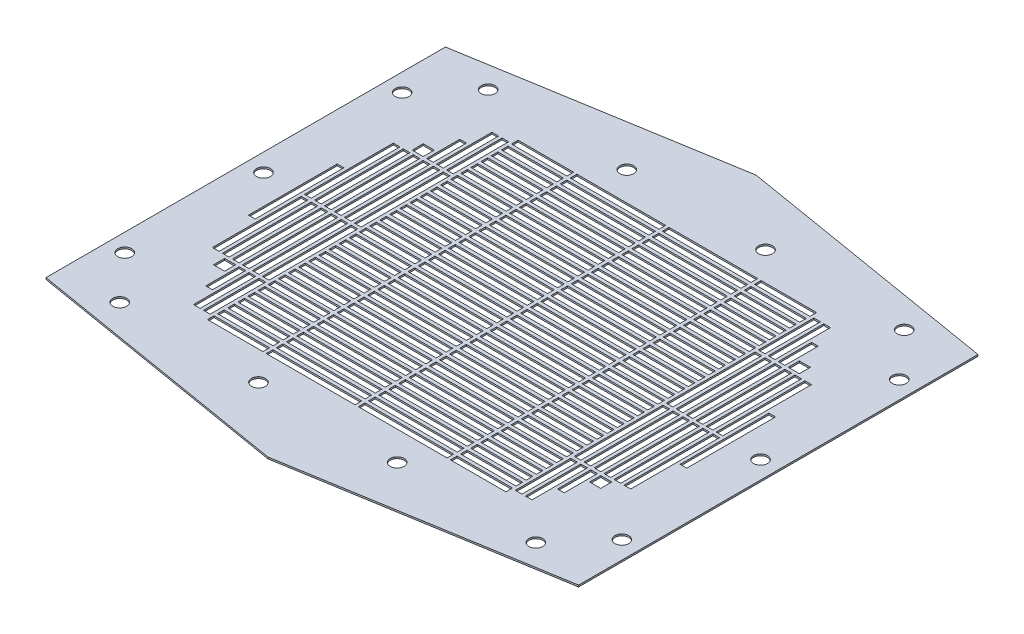
from build123d import *

# Parameters (mm, degrees)
BASE_FLANGE1_DEPTH                    = 200
BASE_FLANGE2_START                    = -1.5
BASE_FLANGE2_DEPTH                    = 1.5
SKETCH9_W                             = 6.25
SKETCH9_H                             = 1.5
F_12_5_12_5_DIAMETER_HOLE2_AT_2_COUNT = 2
F_12_5_12_5_DIAMETER_HOLE2_AT_2_PITCH = 250
F_12_5_12_5_DIAMETER_HOLE2_AT_3_COUNT = 2
F_12_5_12_5_DIAMETER_HOLE2_AT_3_PITCH = 125
F_12_5_12_5_DIAMETER_HOLE2_AT_4_COUNT = 2
F_12_5_12_5_DIAMETER_HOLE2_AT_4_PITCH = 465.111814513
F_12_5_12_5_DIAMETER_HOLE2_AT_5_COUNT = 2
F_12_5_12_5_DIAMETER_HOLE2_AT_5_PITCH = 513.034111926
F_12_5_12_5_DIAMETER_HOLE2_AT_6_COUNT = 2
F_12_5_12_5_DIAMETER_HOLE2_AT_6_PITCH = 448
SKETCH11_W                            = 6.25
SKETCH11_H                            = 1.5
F_12_5_12_5_DIAMETER_HOLE3_AT_2_COUNT = 2
F_12_5_12_5_DIAMETER_HOLE3_AT_2_PITCH = 332
CRVPATTERN1_COUNT                     = 4
CRVPATTERN1_PITCH                     = 125
CRVPATTERN1_COPY_1_SKETCH_W           = 6.25
CRVPATTERN1_COPY_1_SKETCH_H           = 1.5
CRVPATTERN1_COPY_2_SKETCH_W           = 6.25
CRVPATTERN1_COPY_2_SKETCH_H           = 1.5
CRVPATTERN1_COPY_3_SKETCH_W           = 6.25
CRVPATTERN1_COPY_3_SKETCH_H           = 1.5
BASE_FLANGE3_DEPTH                    = 1.5
SKETCH14_W                            = 80
SKETCH14_H                            = 6
SKETCH14_W_2                          = 50
EXTRUDE1_DEPTH                        = 10
CRVPATTERN2_START                     = -81.5
CRVPATTERN2_OUTLINE_W                 = 1.5
CRVPATTERN2_OUTLINE_H                 = 6
CRVPATTERN2_DEPTH                     = 80
CRVPATTERN2_START_2                   = -134.5
CRVPATTERN2_2_OUTLINE_W               = 1.5
CRVPATTERN2_2_OUTLINE_H               = 6
CRVPATTERN2_2_DEPTH                   = 50
SKETCH15_W                            = 6
SKETCH15_H                            = 80
SKETCH15_H_2                          = 50
SKETCH15_H_3                          = 30
SKETCH15_W_2                          = 10
SKETCH15_H_4                          = 10
EXTRUDE2_DEPTH                        = 10


# Read off the part's stored shape, not the designer's step: CrvPattern2
# Sheet-metal steps are written as plain solids
with BuildPart() as part:
    # Sketch1 → Base-Flange1 (new body)
    with BuildSketch(Plane(origin=(0, 0, 0), x_dir=(1, 0, 0), z_dir=(0, 1, 0))):
        with BuildLine():
            ThreePointArc((-0.005, 198.999999937), (0, -199), (0.005, 198.999999937))
            Line((0.005, 198.999999937), (0.005025126, 199.999999937))
            ThreePointArc((0.005025126, 199.999999937), (0, -200), (-0.005025126, 199.999999937))
            Line((-0.005025126, 199.999999937), (-0.005, 198.999999937))
        make_face()
    extrude(amount=BASE_FLANGE1_DEPTH)


with BuildPart() as body_2:
    # Sketch4 → Base-Flange2 (new body)
    with BuildSketch(Plane(origin=(0, 0, 0), x_dir=(1, 0, 0), z_dir=(0, 1, 0)).offset(BASE_FLANGE2_START)):
        Polygon((240, 180), (240, -180), (0, -220), (-240, -180), (-240, 180), (0, 220), align=None)
        with BuildLine():
            Line((143.038535018, 140), (-142.828568571, 140))
            ThreePointArc((-142.828568571, 140), (-200, 0), (-142.828568571, -140))
            Line((-142.828568571, -140), (143.038535018, -140))
            ThreePointArc((143.038535018, -140), (200.15, 0), (143.038535018, 140))
        make_face(mode=Mode.SUBTRACT)
    extrude(amount=BASE_FLANGE2_DEPTH)

    # Sketch9 → Ø12.5 (12.5) Diameter Hole2 (revolve, cut)
    with BuildSketch(Plane(origin=(-224, 0, -125), x_dir=(0, 0, 1), z_dir=(1, 0, 0))):
        with Locations((3.125, 0.75)):
            Rectangle(SKETCH9_W, SKETCH9_H)
    f_12_5_12_5_diameter_hole2 = revolve(axis=Axis((-224, 6.35, -125), (0, -1, 0)), mode=Mode.SUBTRACT)

    # Ø12.5 (12.5) Diameter Hole2 at 2: Ø12.5 (12.5) Diameter Hole2 ×2
    with Locations(*[(0, 0, i * F_12_5_12_5_DIAMETER_HOLE2_AT_2_PITCH) for i in range(1, F_12_5_12_5_DIAMETER_HOLE2_AT_2_COUNT)]):
        add(f_12_5_12_5_diameter_hole2, mode=Mode.SUBTRACT)

    # Ø12.5 (12.5) Diameter Hole2 at 3: Ø12.5 (12.5) Diameter Hole2 ×2
    with Locations(*[(0, 0, i * F_12_5_12_5_DIAMETER_HOLE2_AT_3_PITCH) for i in range(1, F_12_5_12_5_DIAMETER_HOLE2_AT_3_COUNT)]):
        add(f_12_5_12_5_diameter_hole2, mode=Mode.SUBTRACT)

    # Ø12.5 (12.5) Diameter Hole2 at 4: Ø12.5 (12.5) Diameter Hole2 ×2
    with Locations(*[Vector(0.9632092456491202, 0, 0.2687525797012055) * (i * F_12_5_12_5_DIAMETER_HOLE2_AT_4_PITCH) for i in range(1, F_12_5_12_5_DIAMETER_HOLE2_AT_4_COUNT)]):
        add(f_12_5_12_5_diameter_hole2, mode=Mode.SUBTRACT)

    # Ø12.5 (12.5) Diameter Hole2 at 5: Ø12.5 (12.5) Diameter Hole2 ×2
    with Locations(*[Vector(0.8732362811468641, 0, 0.4872970318899912) * (i * F_12_5_12_5_DIAMETER_HOLE2_AT_5_PITCH) for i in range(1, F_12_5_12_5_DIAMETER_HOLE2_AT_5_COUNT)]):
        add(f_12_5_12_5_diameter_hole2, mode=Mode.SUBTRACT)

    # Ø12.5 (12.5) Diameter Hole2 at 6: Ø12.5 (12.5) Diameter Hole2 ×2
    with Locations(*[(i * F_12_5_12_5_DIAMETER_HOLE2_AT_6_PITCH, 0, 0) for i in range(1, F_12_5_12_5_DIAMETER_HOLE2_AT_6_COUNT)]):
        add(f_12_5_12_5_diameter_hole2, mode=Mode.SUBTRACT)

    # Sketch11 → Ø12.5 (12.5) Diameter Hole3 (revolve, cut)
    with BuildSketch(Plane(origin=(-187.5, 0, -166), x_dir=(0, 0, 1), z_dir=(1, 0, 0))):
        with Locations((3.125, 0.75)):
            Rectangle(SKETCH11_W, SKETCH11_H)
    f_12_5_12_5_diameter_hole3 = revolve(axis=Axis((-187.5, 6.35, -166), (0, -1, 0)), mode=Mode.SUBTRACT)

    # Ø12.5 (12.5) Diameter Hole3 at 2: Ø12.5 (12.5) Diameter Hole3 ×2
    with Locations(*[(0, 0, i * F_12_5_12_5_DIAMETER_HOLE3_AT_2_PITCH) for i in range(1, F_12_5_12_5_DIAMETER_HOLE3_AT_2_COUNT)]):
        add(f_12_5_12_5_diameter_hole3, mode=Mode.SUBTRACT)

    # CrvPattern1: Ø12.5 (12.5) Diameter Hole3 ×4
    with Locations(*[(i * CRVPATTERN1_PITCH, 0, 0) for i in range(1, CRVPATTERN1_COUNT)]):
        add(f_12_5_12_5_diameter_hole3, mode=Mode.SUBTRACT)

    # CrvPattern1 copy 1 sketch → CrvPattern1 copy 1 (revolve, cut)
    with BuildSketch(Plane(origin=(-62.5, 0, 166), x_dir=(0, 0, 1), z_dir=(1, 0, 0))):
        with Locations((3.125, 0.75)):
            Rectangle(CRVPATTERN1_COPY_1_SKETCH_W, CRVPATTERN1_COPY_1_SKETCH_H)
    revolve(axis=Axis((-62.5, 6.35, 166), (0, -1, 0)), mode=Mode.SUBTRACT)

    # CrvPattern1 copy 2 sketch → CrvPattern1 copy 2 (revolve, cut)
    with BuildSketch(Plane(origin=(62.5, 0, 166), x_dir=(0, 0, 1), z_dir=(1, 0, 0))):
        with Locations((3.125, 0.75)):
            Rectangle(CRVPATTERN1_COPY_2_SKETCH_W, CRVPATTERN1_COPY_2_SKETCH_H)
    revolve(axis=Axis((62.5, 6.35, 166), (0, -1, 0)), mode=Mode.SUBTRACT)

    # CrvPattern1 copy 3 sketch → CrvPattern1 copy 3 (revolve, cut)
    with BuildSketch(Plane(origin=(187.5, 0, 166), x_dir=(0, 0, 1), z_dir=(1, 0, 0))):
        with Locations((3.125, 0.75)):
            Rectangle(CRVPATTERN1_COPY_3_SKETCH_W, CRVPATTERN1_COPY_3_SKETCH_H)
    revolve(axis=Axis((187.5, 6.35, 166), (0, -1, 0)), mode=Mode.SUBTRACT)

    # Sketch13 → Base-Flange3 (add)
    with BuildSketch(Plane.XZ.offset(1.5)):
        with BuildLine():
            Line((-142.828568571, -140), (143.038535018, -140))
            ThreePointArc((143.038535018, -140), (200.15, 0), (143.038535018, 140))
            Line((143.038535018, 140), (-142.828568571, 140))
            ThreePointArc((-142.828568571, 140), (-200, 0), (-142.828568571, -140))
        make_face()
    extrude(amount=-BASE_FLANGE3_DEPTH)

    # Sketch14 → Extrude1 (cut)
    with BuildSketch(Plane(origin=(0, 0, 0), x_dir=(1, 0, 0), z_dir=(0, 1, 0))):
        with Locations((-41.5, 137)):
            Rectangle(SKETCH14_W, SKETCH14_H)
        with Locations((-109.5, 137)):
            Rectangle(SKETCH14_W_2, SKETCH14_H)
    extrude1 = extrude(amount=-EXTRUDE1_DEPTH, mode=Mode.SUBTRACT)

    # CrvPattern2 outline → CrvPattern2 (cut)
    with BuildSketch(Plane.YZ.offset(CRVPATTERN2_START)):
        with Locations((-0.75, -127.866666667)):
            Rectangle(CRVPATTERN2_OUTLINE_W, CRVPATTERN2_OUTLINE_H)
        with Locations((-0.75, -118.733333333)):
            Rectangle(CRVPATTERN2_OUTLINE_W, CRVPATTERN2_OUTLINE_H)
        with Locations((-0.75, -109.6)):
            Rectangle(CRVPATTERN2_OUTLINE_W, CRVPATTERN2_OUTLINE_H)
        with Locations((-0.75, -100.466666667)):
            Rectangle(CRVPATTERN2_OUTLINE_W, CRVPATTERN2_OUTLINE_H)
        with Locations((-0.75, -91.333333333)):
            Rectangle(CRVPATTERN2_OUTLINE_W, CRVPATTERN2_OUTLINE_H)
        with Locations((-0.75, -82.2)):
            Rectangle(CRVPATTERN2_OUTLINE_W, CRVPATTERN2_OUTLINE_H)
        with Locations((-0.75, -73.066666667)):
            Rectangle(CRVPATTERN2_OUTLINE_W, CRVPATTERN2_OUTLINE_H)
        with Locations((-0.75, -63.933333333)):
            Rectangle(CRVPATTERN2_OUTLINE_W, CRVPATTERN2_OUTLINE_H)
        with Locations((-0.75, -54.8)):
            Rectangle(CRVPATTERN2_OUTLINE_W, CRVPATTERN2_OUTLINE_H)
        with Locations((-0.75, -45.666666667)):
            Rectangle(CRVPATTERN2_OUTLINE_W, CRVPATTERN2_OUTLINE_H)
        with Locations((-0.75, -36.533333333)):
            Rectangle(CRVPATTERN2_OUTLINE_W, CRVPATTERN2_OUTLINE_H)
        with Locations((-0.75, -27.4)):
            Rectangle(CRVPATTERN2_OUTLINE_W, CRVPATTERN2_OUTLINE_H)
        with Locations((-0.75, -18.266666667)):
            Rectangle(CRVPATTERN2_OUTLINE_W, CRVPATTERN2_OUTLINE_H)
        with Locations((-0.75, -9.133333333)):
            Rectangle(CRVPATTERN2_OUTLINE_W, CRVPATTERN2_OUTLINE_H)
        with Locations((-0.75, 0)):
            Rectangle(CRVPATTERN2_OUTLINE_W, CRVPATTERN2_OUTLINE_H)
        with Locations((-0.75, 9.133333333)):
            Rectangle(CRVPATTERN2_OUTLINE_W, CRVPATTERN2_OUTLINE_H)
        with Locations((-0.75, 18.266666667)):
            Rectangle(CRVPATTERN2_OUTLINE_W, CRVPATTERN2_OUTLINE_H)
        with Locations((-0.75, 27.4)):
            Rectangle(CRVPATTERN2_OUTLINE_W, CRVPATTERN2_OUTLINE_H)
        with Locations((-0.75, 36.533333333)):
            Rectangle(CRVPATTERN2_OUTLINE_W, CRVPATTERN2_OUTLINE_H)
        with Locations((-0.75, 45.666666667)):
            Rectangle(CRVPATTERN2_OUTLINE_W, CRVPATTERN2_OUTLINE_H)
        with Locations((-0.75, 54.8)):
            Rectangle(CRVPATTERN2_OUTLINE_W, CRVPATTERN2_OUTLINE_H)
        with Locations((-0.75, 63.933333333)):
            Rectangle(CRVPATTERN2_OUTLINE_W, CRVPATTERN2_OUTLINE_H)
        with Locations((-0.75, 73.066666667)):
            Rectangle(CRVPATTERN2_OUTLINE_W, CRVPATTERN2_OUTLINE_H)
        with Locations((-0.75, 82.2)):
            Rectangle(CRVPATTERN2_OUTLINE_W, CRVPATTERN2_OUTLINE_H)
        with Locations((-0.75, 91.333333333)):
            Rectangle(CRVPATTERN2_OUTLINE_W, CRVPATTERN2_OUTLINE_H)
        with Locations((-0.75, 100.466666667)):
            Rectangle(CRVPATTERN2_OUTLINE_W, CRVPATTERN2_OUTLINE_H)
        with Locations((-0.75, 109.6)):
            Rectangle(CRVPATTERN2_OUTLINE_W, CRVPATTERN2_OUTLINE_H)
        with Locations((-0.75, 118.733333333)):
            Rectangle(CRVPATTERN2_OUTLINE_W, CRVPATTERN2_OUTLINE_H)
        with Locations((-0.75, 127.866666667)):
            Rectangle(CRVPATTERN2_OUTLINE_W, CRVPATTERN2_OUTLINE_H)
        with Locations((-0.75, 137)):
            Rectangle(CRVPATTERN2_OUTLINE_W, CRVPATTERN2_OUTLINE_H)
    crvpattern2 = extrude(amount=CRVPATTERN2_DEPTH, mode=Mode.SUBTRACT)

    # CrvPattern2 2 outline → CrvPattern2 2 (cut)
    with BuildSketch(Plane.YZ.offset(CRVPATTERN2_START_2)):
        with Locations((-0.75, -127.866666667)):
            Rectangle(CRVPATTERN2_2_OUTLINE_W, CRVPATTERN2_2_OUTLINE_H)
        with Locations((-0.75, -118.733333333)):
            Rectangle(CRVPATTERN2_2_OUTLINE_W, CRVPATTERN2_2_OUTLINE_H)
        with Locations((-0.75, -109.6)):
            Rectangle(CRVPATTERN2_2_OUTLINE_W, CRVPATTERN2_2_OUTLINE_H)
        with Locations((-0.75, -100.466666667)):
            Rectangle(CRVPATTERN2_2_OUTLINE_W, CRVPATTERN2_2_OUTLINE_H)
        with Locations((-0.75, -91.333333333)):
            Rectangle(CRVPATTERN2_2_OUTLINE_W, CRVPATTERN2_2_OUTLINE_H)
        with Locations((-0.75, -82.2)):
            Rectangle(CRVPATTERN2_2_OUTLINE_W, CRVPATTERN2_2_OUTLINE_H)
        with Locations((-0.75, -73.066666667)):
            Rectangle(CRVPATTERN2_2_OUTLINE_W, CRVPATTERN2_2_OUTLINE_H)
        with Locations((-0.75, -63.933333333)):
            Rectangle(CRVPATTERN2_2_OUTLINE_W, CRVPATTERN2_2_OUTLINE_H)
        with Locations((-0.75, -54.8)):
            Rectangle(CRVPATTERN2_2_OUTLINE_W, CRVPATTERN2_2_OUTLINE_H)
        with Locations((-0.75, -45.666666667)):
            Rectangle(CRVPATTERN2_2_OUTLINE_W, CRVPATTERN2_2_OUTLINE_H)
        with Locations((-0.75, -36.533333333)):
            Rectangle(CRVPATTERN2_2_OUTLINE_W, CRVPATTERN2_2_OUTLINE_H)
        with Locations((-0.75, -27.4)):
            Rectangle(CRVPATTERN2_2_OUTLINE_W, CRVPATTERN2_2_OUTLINE_H)
        with Locations((-0.75, -18.266666667)):
            Rectangle(CRVPATTERN2_2_OUTLINE_W, CRVPATTERN2_2_OUTLINE_H)
        with Locations((-0.75, -9.133333333)):
            Rectangle(CRVPATTERN2_2_OUTLINE_W, CRVPATTERN2_2_OUTLINE_H)
        with Locations((-0.75, 0)):
            Rectangle(CRVPATTERN2_2_OUTLINE_W, CRVPATTERN2_2_OUTLINE_H)
        with Locations((-0.75, 9.133333333)):
            Rectangle(CRVPATTERN2_2_OUTLINE_W, CRVPATTERN2_2_OUTLINE_H)
        with Locations((-0.75, 18.266666667)):
            Rectangle(CRVPATTERN2_2_OUTLINE_W, CRVPATTERN2_2_OUTLINE_H)
        with Locations((-0.75, 27.4)):
            Rectangle(CRVPATTERN2_2_OUTLINE_W, CRVPATTERN2_2_OUTLINE_H)
        with Locations((-0.75, 36.533333333)):
            Rectangle(CRVPATTERN2_2_OUTLINE_W, CRVPATTERN2_2_OUTLINE_H)
        with Locations((-0.75, 45.666666667)):
            Rectangle(CRVPATTERN2_2_OUTLINE_W, CRVPATTERN2_2_OUTLINE_H)
        with Locations((-0.75, 54.8)):
            Rectangle(CRVPATTERN2_2_OUTLINE_W, CRVPATTERN2_2_OUTLINE_H)
        with Locations((-0.75, 63.933333333)):
            Rectangle(CRVPATTERN2_2_OUTLINE_W, CRVPATTERN2_2_OUTLINE_H)
        with Locations((-0.75, 73.066666667)):
            Rectangle(CRVPATTERN2_2_OUTLINE_W, CRVPATTERN2_2_OUTLINE_H)
        with Locations((-0.75, 82.2)):
            Rectangle(CRVPATTERN2_2_OUTLINE_W, CRVPATTERN2_2_OUTLINE_H)
        with Locations((-0.75, 91.333333333)):
            Rectangle(CRVPATTERN2_2_OUTLINE_W, CRVPATTERN2_2_OUTLINE_H)
        with Locations((-0.75, 100.466666667)):
            Rectangle(CRVPATTERN2_2_OUTLINE_W, CRVPATTERN2_2_OUTLINE_H)
        with Locations((-0.75, 109.6)):
            Rectangle(CRVPATTERN2_2_OUTLINE_W, CRVPATTERN2_2_OUTLINE_H)
        with Locations((-0.75, 118.733333333)):
            Rectangle(CRVPATTERN2_2_OUTLINE_W, CRVPATTERN2_2_OUTLINE_H)
        with Locations((-0.75, 127.866666667)):
            Rectangle(CRVPATTERN2_2_OUTLINE_W, CRVPATTERN2_2_OUTLINE_H)
        with Locations((-0.75, 137)):
            Rectangle(CRVPATTERN2_2_OUTLINE_W, CRVPATTERN2_2_OUTLINE_H)
    crvpattern2_2 = extrude(amount=CRVPATTERN2_2_DEPTH, mode=Mode.SUBTRACT)

    # Sketch15 → Extrude2 (cut)
    with BuildSketch(Plane(origin=(0, 0, 0), x_dir=(1, 0, 0), z_dir=(0, 1, 0))):
        with Locations((-140.5, 41.5)):
            Rectangle(SKETCH15_W, SKETCH15_H)
        with Locations((-140.5, 109.5)):
            Rectangle(SKETCH15_W, SKETCH15_H_2)
        with Locations((-149.5, 41.5)):
            Rectangle(SKETCH15_W, SKETCH15_H)
        with Locations((-149.5, 109.5)):
            Rectangle(SKETCH15_W, SKETCH15_H_2)
        with Locations((-158.5, 41.5)):
            Rectangle(SKETCH15_W, SKETCH15_H)
        with Locations((-167.5, 41.5)):
            Rectangle(SKETCH15_W, SKETCH15_H)
        with Locations((-176.5, 41.5)):
            Rectangle(SKETCH15_W, SKETCH15_H)
        with Locations((-185.5, 41.5)):
            Rectangle(SKETCH15_W, SKETCH15_H)
        with Locations((-158.5, 99.5)):
            Rectangle(SKETCH15_W, SKETCH15_H_3)
        with Locations((-169.5, 89.5)):
            Rectangle(SKETCH15_W_2, SKETCH15_H_4)
        with Locations((-169.5, -89.5)):
            Rectangle(SKETCH15_W_2, SKETCH15_H_4)
        with Locations((-158.5, -99.5)):
            Rectangle(SKETCH15_W, SKETCH15_H_3)
        with Locations((-185.5, -41.5)):
            Rectangle(SKETCH15_W, SKETCH15_H)
        with Locations((-176.5, -41.5)):
            Rectangle(SKETCH15_W, SKETCH15_H)
        with Locations((-167.5, -41.5)):
            Rectangle(SKETCH15_W, SKETCH15_H)
        with Locations((-158.5, -41.5)):
            Rectangle(SKETCH15_W, SKETCH15_H)
        with Locations((-149.5, -109.5)):
            Rectangle(SKETCH15_W, SKETCH15_H_2)
        with Locations((-149.5, -41.5)):
            Rectangle(SKETCH15_W, SKETCH15_H)
        with Locations((-140.5, -109.5)):
            Rectangle(SKETCH15_W, SKETCH15_H_2)
        with Locations((-140.5, -41.5)):
            Rectangle(SKETCH15_W, SKETCH15_H)
        with Locations((-194.5, 0)):
            Rectangle(SKETCH15_W, SKETCH15_H)
    extrude2 = extrude(amount=-EXTRUDE2_DEPTH, mode=Mode.SUBTRACT)

    # Mirror1: Extrude1, CrvPattern2, CrvPattern2 2, Extrude2 across plane
    add(extrude1.mirror(Plane(origin=(0, 0, 0), x_dir=(0, 0, 1), z_dir=(1, 0, 0))), mode=Mode.SUBTRACT)
    add(crvpattern2.mirror(Plane(origin=(0, 0, 0), x_dir=(0, 0, 1), z_dir=(1, 0, 0))), mode=Mode.SUBTRACT)
    add(crvpattern2_2.mirror(Plane(origin=(0, 0, 0), x_dir=(0, 0, 1), z_dir=(1, 0, 0))), mode=Mode.SUBTRACT)
    add(extrude2.mirror(Plane(origin=(0, 0, 0), x_dir=(0, 0, 1), z_dir=(1, 0, 0))), mode=Mode.SUBTRACT)


solid = body_2.part
